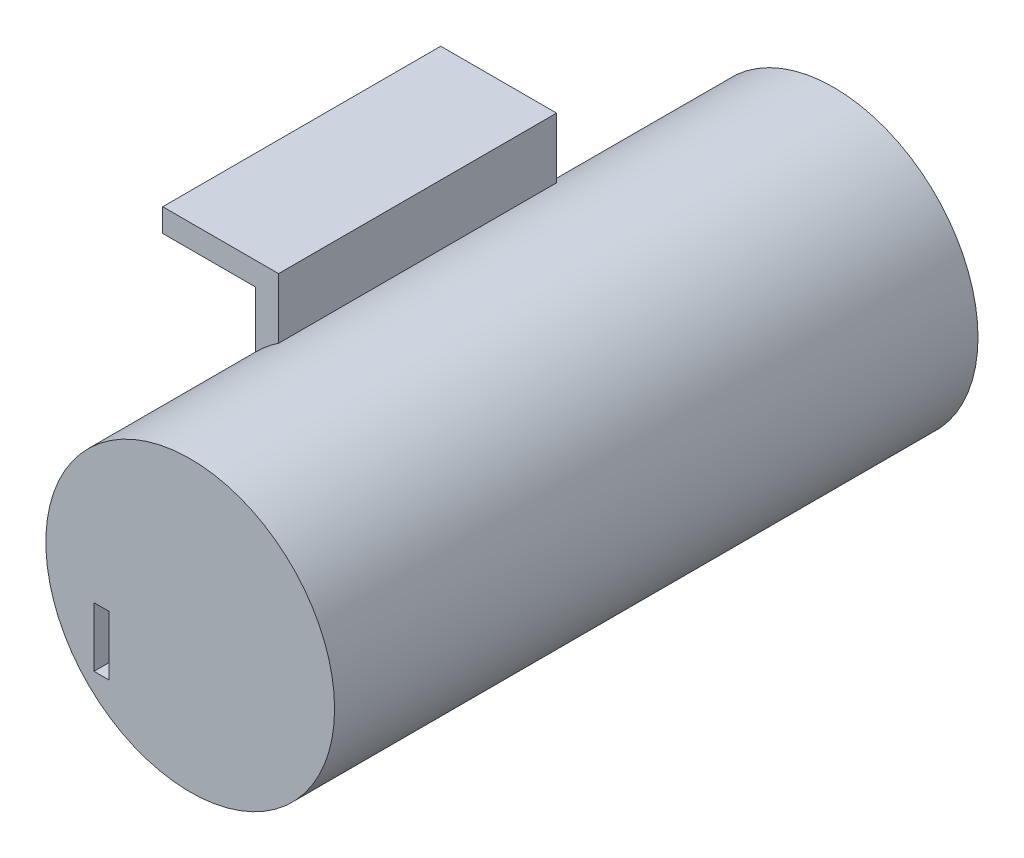
from build123d import *

# Parameters (mm, degrees)
BOSS_EXTRUDE1_DEPTH      = 38.1
BOSS_EXTRUDE2_DEPTH      = 27
BOSS_EXTRUDE2_DEPTH_BACK = 58
SKETCH2_R                = 19.784587186
SKETCH2_R_2              = 18.4
SKETCH3_R                = 19.784587186
BOSS_EXTRUDE3_DEPTH      = 3.175
SKETCH4_W                = 2.053355329
SKETCH4_H                = 8.144976138
CUT_EXTRUDE1_DEPTH       = 3.175


with BuildPart() as part:
    # Sketch1 → Boss-Extrude1 (new body)
    with BuildSketch(Plane.XY):
        Polygon((-6.637006615, 11.87570212), (-22.512006615, 11.87570212), (-22.512006615, 8.70070212), (-9.812006615, 8.70070212), (-9.812006615, 0.87570212), (-6.637006615, 0.87570212), align=None)
    extrude(amount=BOSS_EXTRUDE1_DEPTH)

    # Sketch2 → Boss-Extrude2 (add, two sides: drawn at the far end of the back side and taken through both)
    with BuildSketch(Plane(origin=(0, 0, 0), x_dir=(-1, 0, 0), z_dir=(0, 0, -1)).offset(-BOSS_EXTRUDE2_DEPTH_BACK)):
        with Locations((-4.329778131, -12.861954284)):
            Circle(SKETCH2_R)
        with Locations((-4.329778131, -12.861954284)):
            Circle(SKETCH2_R_2, mode=Mode.SUBTRACT)
    extrude(amount=BOSS_EXTRUDE2_DEPTH + BOSS_EXTRUDE2_DEPTH_BACK)

    # Sketch3 → Boss-Extrude3 (add)
    with BuildSketch(Plane.XY.offset(58)):
        with Locations((4.329778131, -12.861954284)):
            Circle(SKETCH3_R)
    extrude(amount=BOSS_EXTRUDE3_DEPTH)

    # Sketch4 → Cut-Extrude1 (cut)
    with BuildSketch(Plane.XY.offset(61.175)):
        with Locations((-7.822913032, -20.823309264)):
            Rectangle(SKETCH4_W, SKETCH4_H)
    extrude(amount=-CUT_EXTRUDE1_DEPTH, mode=Mode.SUBTRACT)


solid = part.part
